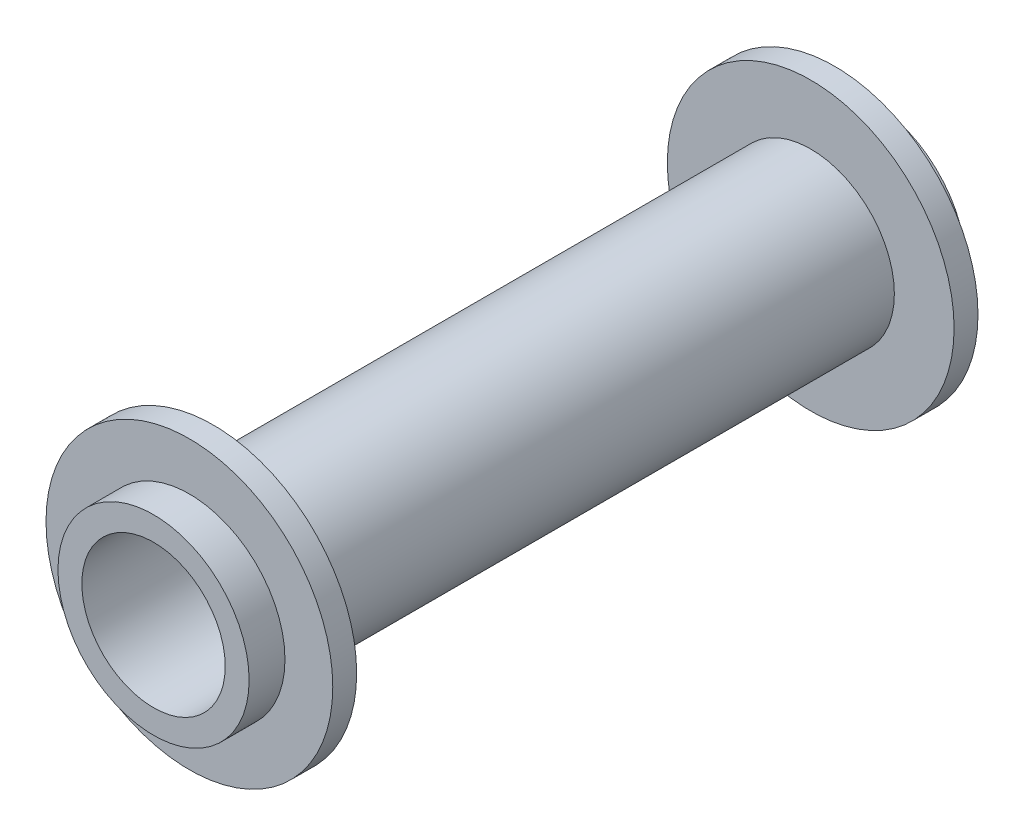
from build123d import *


with BuildPart() as part:
    # Sketch2 → Revolve1 (revolve)
    with BuildSketch(Plane(origin=(0, 0, 0), x_dir=(0, 0, -1), z_dir=(1, 0, 0))):
        Polygon((0, 6), (0, 8), (3, 8), (3, 12), (5, 12), (5, 7), (55, 7), (55, 12), (57, 12), (57, 8), (60, 8), (60, 6), align=None)
    revolve(axis=Axis((0, 0, 0), (0, 0, -1)))


solid = part.part
